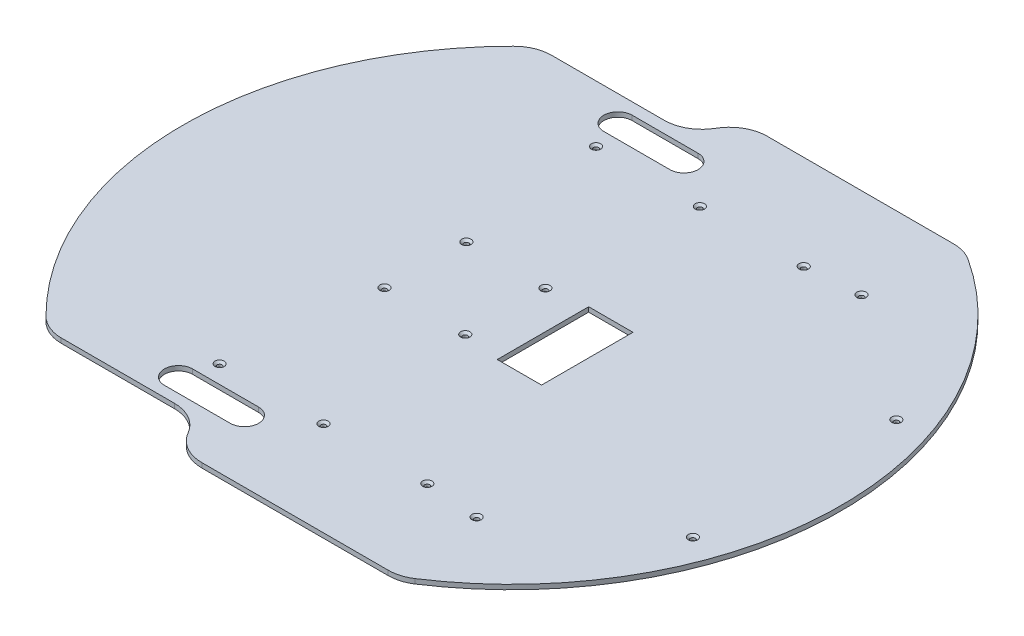
from build123d import *

# Parameters (mm, degrees)
BOSS_EXTRU_1_DEPTH                             = 3.18
ESQUISSE2_W                                    = 29.85
ESQUISSE2_H                                    = 61.6
ENL_V_MAT_EXTRU_1_DEPTH                        = 3.18
FRAISAGE_POUR_VIS_T_TE_FRAIS_E_M31_D           = 3.4
FRAISAGE_POUR_VIS_T_TE_FRAIS_E_M31_CSINK_D     = 6.3
FRAISAGE_POUR_VIS_T_TE_FRAIS_E_M31_CSINK_ANGLE = 90
FRAISAGE_POUR_VIS_T_TE_FRAIS_E_M32_D           = 3.4
FRAISAGE_POUR_VIS_T_TE_FRAIS_E_M32_CSINK_D     = 6.3
FRAISAGE_POUR_VIS_T_TE_FRAIS_E_M32_CSINK_ANGLE = 90


with BuildPart() as part:
    # Esquisse1 → Boss.-Extru.1 (new body)
    with BuildSketch(Plane(origin=(0, 0, 0), x_dir=(1, 0, 0), z_dir=(0, 1, 0))):
        with BuildLine():
            Line((-138.94, 165.455), (-62.65, 165.455))
            ThreePointArc((-62.65, 165.455), (-49.94832469, 168.857215998), (-40.65, 178.155))
            ThreePointArc((-40.65, 178.155), (-31.35167531, 187.452784002), (-18.65, 190.855))
            Line((-18.65, 190.855), (106.95, 190.855))
            ThreePointArc((106.95, 190.855), (114.162170552, 189.807407008), (120.78, 186.755))
            ThreePointArc((120.78, 186.755), (221.783950682, 0.355), (120.78, -186.045))
            ThreePointArc((120.78, -186.045), (114.162170552, -189.097407008), (106.95, -190.145))
            Line((106.95, -190.145), (-18.65, -190.145))
            ThreePointArc((-18.65, -190.145), (-31.35167531, -186.742784002), (-40.65, -177.445))
            ThreePointArc((-40.65, -177.445), (-49.94832469, -168.147215998), (-62.65, -164.745))
            Line((-62.65, -164.745), (-138.94, -164.745))
            ThreePointArc((-138.94, -164.745), (-148.655863056, -162.664054344), (-156.83, -157.015))
            ThreePointArc((-156.83, -157.015), (-222.037491914, 0.355), (-156.83, 157.725))
            ThreePointArc((-156.83, 157.725), (-148.655863056, 163.374054344), (-138.94, 165.455))
        make_face()
    extrude(amount=BOSS_EXTRU_1_DEPTH)

    # Esquisse2 → Enlèv. mat.-Extru.1 (cut)
    with BuildSketch(Plane(origin=(0, 3.18, 0), x_dir=(1, 0, 0), z_dir=(0, 1, 0))):
        with BuildLine():
            Line((-76.45, -138.575), (-32, -138.575))
            ThreePointArc((-32, -138.575), (-22.47, -148.105), (-32, -157.635))
            Line((-32, -157.635), (-76.45, -157.635))
            ThreePointArc((-76.45, -157.635), (-85.98, -148.105), (-76.45, -138.575))
        make_face()
        with BuildLine():
            Line((-76.45, 138.575), (-32, 138.575))
            ThreePointArc((-32, 138.575), (-22.47, 148.105), (-32, 157.635))
            Line((-32, 157.635), (-76.45, 157.635))
            ThreePointArc((-76.45, 157.635), (-85.98, 148.105), (-76.45, 138.575))
        make_face()
        with Locations((35.625, 0.375)):
            Rectangle(ESQUISSE2_W, ESQUISSE2_H)
    extrude(amount=-ENL_V_MAT_EXTRU_1_DEPTH, mode=Mode.SUBTRACT)

    # Fraisage pour vis à tête fraisée M31 (through all)
    with Locations(Plane(origin=(-70.35, 3.18, 126.475), x_dir=(0, 0, 1), z_dir=(0, 1, 0))):
        with Locations((0, 0), (0, 69.98), (0, 139.96), (2.87, 176.05), (-58.27, 260.67), (-195.39, 260.67), (-256.53, 176.05), (-253.66, 139.96), (-253.66, 69.98), (-253.66, 0)):
            CounterSinkHole(FRAISAGE_POUR_VIS_T_TE_FRAIS_E_M31_D / 2, FRAISAGE_POUR_VIS_T_TE_FRAIS_E_M31_CSINK_D / 2, counter_sink_angle=FRAISAGE_POUR_VIS_T_TE_FRAIS_E_M31_CSINK_ANGLE)

    # Fraisage pour vis à tête fraisée M32 (through all)
    with Locations(Plane(origin=(-59.229991385, 3.18, 26.524353085), x_dir=(0, 0, 1), z_dir=(0, 1, 0))):
        with Locations((0, 0), (-54.353332715, 0.851365241), (-53.969353085, 54.509991385), (0.030646915, 54.509991385)):
            CounterSinkHole(FRAISAGE_POUR_VIS_T_TE_FRAIS_E_M32_D / 2, FRAISAGE_POUR_VIS_T_TE_FRAIS_E_M32_CSINK_D / 2, counter_sink_angle=FRAISAGE_POUR_VIS_T_TE_FRAIS_E_M32_CSINK_ANGLE)


solid = part.part
